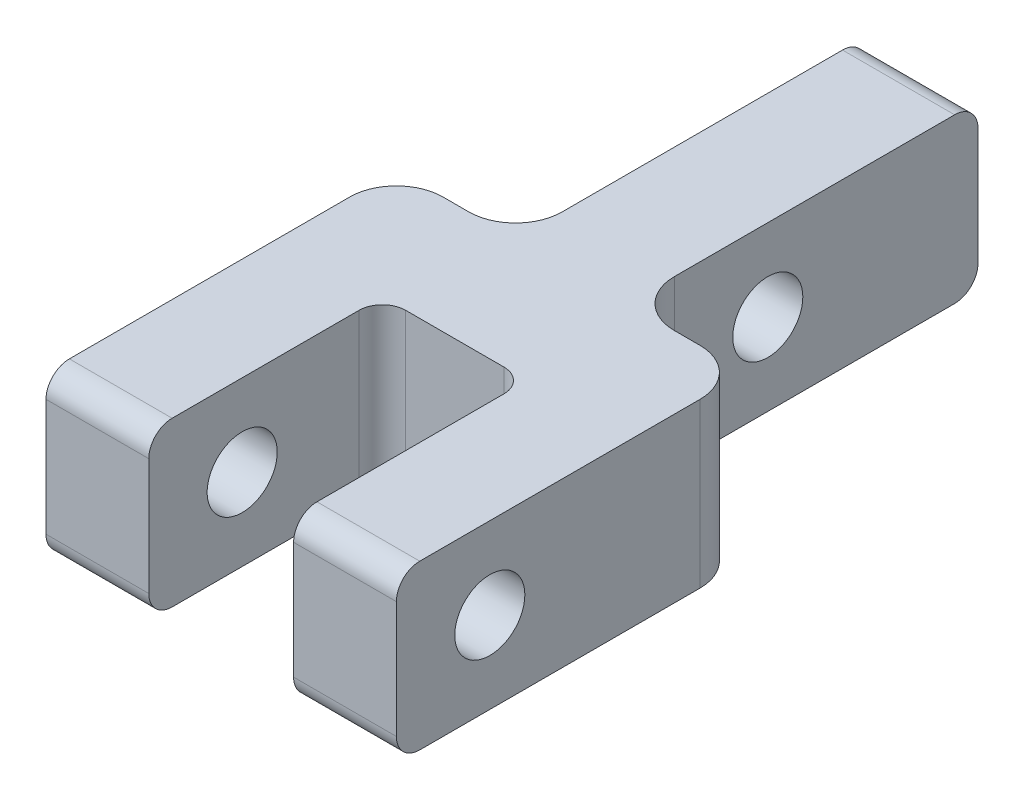
from build123d import *
from build123d.topology import SkipClean

# Parameters (mm, degrees)
SALIENTE_EXTRUIR1_DEPTH    = 2.4
CORTAR_EXTRUIR1_DEPTH      = 16.588778015
CORTAR_EXTRUIR1_DEPTH_BACK = 16.588778015
CROQUIS2_R                 = 1.5
CROQUIS3_R                 = 1.5
SALIENTE_EXTRUIR2_DEPTH    = 7.5
CORTAR_EXTRUIR2_DEPTH      = 3.1
REDONDEO1_R                = 2
REDONDEO2_R                = 1


with BuildPart() as part:
    # Croquis1 → Saliente-Extruir1 (new, symmetric)
    with BuildSketch(Plane(origin=(0, 0, 0), x_dir=(0, 0, -1), z_dir=(1, 0, 0))):
        with BuildLine():
            Line((-14, 3.5), (14, 3.5))
            ThreePointArc((14, 3.5), (14.707106781, 3.207106781), (15, 2.5))
            Line((15, 2.5), (15, -2.5))
            ThreePointArc((15, -2.5), (14.707106781, -3.207106781), (14, -3.5))
            Line((14, -3.5), (-14, -3.5))
            ThreePointArc((-14, -3.5), (-14.707106781, -3.207106781), (-15, -2.5))
            Line((-15, -2.5), (-15, 2.5))
            ThreePointArc((-15, 2.5), (-14.707106781, 3.207106781), (-14, 3.5))
        make_face()
    extrude(amount=SALIENTE_EXTRUIR1_DEPTH, both=True)

    # Croquis2 → Cortar-Extruir1 (cut, two sides: drawn at the far end of the back side and taken through both)
    with BuildSketch(Plane(origin=(0, 0, 0), x_dir=(0, 0, -1), z_dir=(1, 0, 0)).offset(-CORTAR_EXTRUIR1_DEPTH_BACK)):
        with Locations((-11, 0)):
            Circle(CROQUIS2_R)
        with Locations((6, 0)):
            Circle(CROQUIS2_R)
    extrude(amount=CORTAR_EXTRUIR1_DEPTH + CORTAR_EXTRUIR1_DEPTH_BACK, mode=Mode.SUBTRACT)

    # Croquis3 → Saliente-Extruir2 (add, symmetric)
    with SkipClean():  # the faces are left unmerged after this step: merging them gives an invalid solid
        with BuildSketch(Plane(origin=(0, 0, 0), x_dir=(0, 0, -1), z_dir=(1, 0, 0))):
            with BuildLine():
                Line((-15, 2.5), (-15, -2.5))
                ThreePointArc((-15, -2.5), (-14.707106781, -3.207106781), (-14, -3.5))
                Line((-14, -3.5), (0, -3.5))
                Line((0, -3.5), (0, 3.5))
                Line((0, 3.5), (-14, 3.5))
                ThreePointArc((-14, 3.5), (-14.707106781, 3.207106781), (-15, 2.5))
            make_face()
            with Locations((-11, 0)):
                Circle(CROQUIS3_R, mode=Mode.SUBTRACT)
        extrude(amount=SALIENTE_EXTRUIR2_DEPTH, both=True)
    add(part.part.scale(1), mode=Mode.REPLACE)  # the faces are merged on a copy

    # Croquis4 → Cortar-Extruir2 (cut, symmetric)
    with BuildSketch(Plane(origin=(0, 0, 0), x_dir=(0, 0, -1), z_dir=(1, 0, 0))):
        with BuildLine():
            Line((-14, 3.5), (-5, 3.5))
            Line((-5, 3.5), (-5, -3.5))
            Line((-5, -3.5), (-14, -3.5))
            ThreePointArc((-14, -3.5), (-14.707106781, -3.207106781), (-15, -2.5))
            Line((-15, -2.5), (-15, 2.5))
            ThreePointArc((-15, 2.5), (-14.707106781, 3.207106781), (-14, 3.5))
        make_face()
    extrude(amount=CORTAR_EXTRUIR2_DEPTH, both=True, mode=Mode.SUBTRACT)

    # Redondeo1
    redondeo1_edges = [part.edges().sort_by_distance(p)[0] for p in [
        (2.4, 0, 0),
        (-2.4, 0, 0),
        (7.5, 0, 0),
        (-7.5, 0, 0),
    ]]
    fillet(redondeo1_edges, radius=REDONDEO1_R)

    # Redondeo2
    redondeo2_edges = [part.edges().sort_by_distance(p)[0] for p in [
        (3.1, 0, 5),
        (-3.1, 0, 5),
    ]]
    fillet(redondeo2_edges, radius=REDONDEO2_R)


solid = part.part
